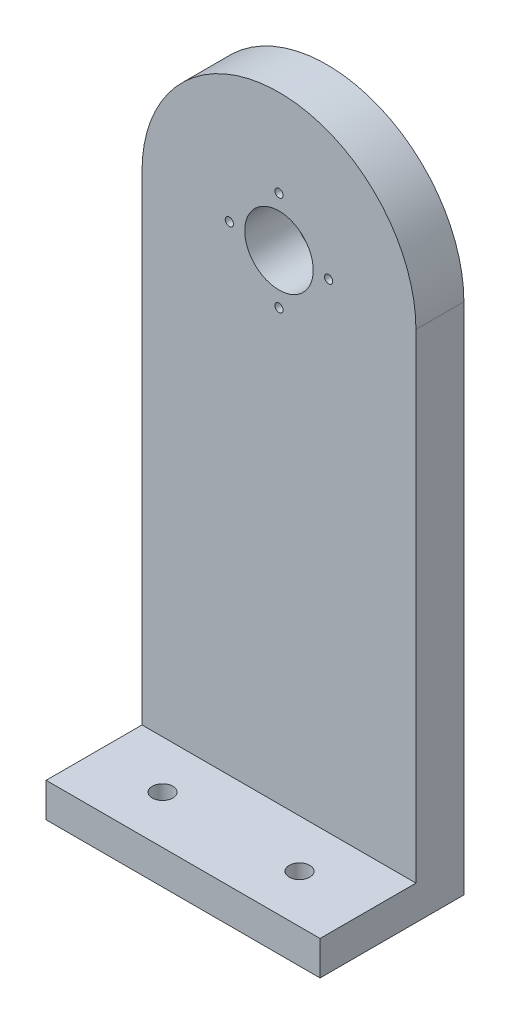
from build123d import *

# Parameters (mm, degrees)
SKETCH1_R           = 5
SKETCH1_R_2         = 0.6
BOSS_EXTRUDE1_DEPTH = 7
SKETCH2_W           = 40
SKETCH2_H           = 5
BOSS_EXTRUDE2_DEPTH = 14
SKETCH3_R           = 1.5
CUT_EXTRUDE1_DEPTH  = 95.5568612


with BuildPart() as part:
    # Sketch1 → Boss-Extrude1 (new body)
    with BuildSketch(Plane.XY):
        with BuildLine():
            Line((20, 0), (20, -75))
            Line((20, -75), (-20, -75))
            Line((-20, -75), (-20, 0))
            ThreePointArc((-20, 0), (0, 20), (20, 0))
        make_face()
        Circle(SKETCH1_R, mode=Mode.SUBTRACT)
        with Locations((0, 7.25)):
            Circle(SKETCH1_R_2, mode=Mode.SUBTRACT)
        with Locations((-7.25, 0)):
            Circle(SKETCH1_R_2, mode=Mode.SUBTRACT)
        with Locations((0, -7.25)):
            Circle(SKETCH1_R_2, mode=Mode.SUBTRACT)
        with Locations((7.25, 0)):
            Circle(SKETCH1_R_2, mode=Mode.SUBTRACT)
    extrude(amount=BOSS_EXTRUDE1_DEPTH)

    # Sketch2 → Boss-Extrude2 (add)
    with BuildSketch(Plane.XY.offset(7)):
        with Locations((0, -72.5)):
            Rectangle(SKETCH2_W, SKETCH2_H)
    extrude(amount=BOSS_EXTRUDE2_DEPTH)

    # Sketch3 → Cut-Extrude1 (cut, through all)
    with BuildSketch(Plane(origin=(0, -70, 0), x_dir=(1, 0, 0), z_dir=(0, 1, 0))):
        with Locations((-10, -14)):
            Circle(SKETCH3_R)
        with Locations((10, -14)):
            Circle(SKETCH3_R)
    extrude(amount=-CUT_EXTRUDE1_DEPTH, mode=Mode.SUBTRACT)


solid = part.part
